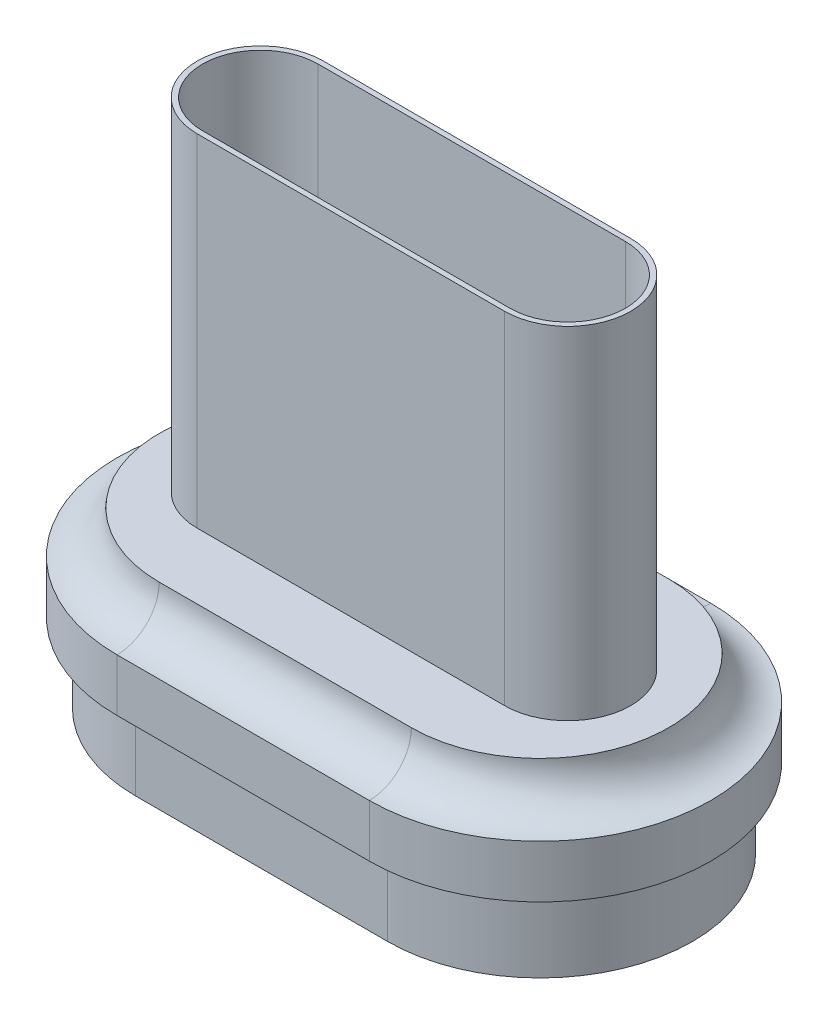
from build123d import *

# Parameters (mm, degrees)
BOSS_EXTRUDE1_DEPTH = 1.5
BOSS_EXTRUDE2_DEPTH = 1
BOSS_EXTRUDE4_DEPTH = 0.8
BOSS_EXTRUDE3_DEPTH = 6.5
FILLET1_R           = 0.8


with BuildPart() as part:
    # Sketch1 → Boss-Extrude1 (new body)
    with BuildSketch(Plane(origin=(0, 0, 0), x_dir=(1, 0, 0), z_dir=(0, 1, 0))):
        with BuildLine():
            Line((-2.4, 2.9), (2.4, 2.9))
            ThreePointArc((2.4, 2.9), (5.3, 0), (2.4, -2.9))
            Line((2.4, -2.9), (-2.4, -2.9))
            ThreePointArc((-2.4, -2.9), (-5.3, 0), (-2.4, 2.9))
        make_face()
        with BuildLine():
            Line((-2.4, 1.4), (2.4, 1.4))
            ThreePointArc((2.4, 1.4), (3.8, 0), (2.4, -1.4))
            Line((2.4, -1.4), (-2.4, -1.4))
            ThreePointArc((-2.4, -1.4), (-3.8, 0), (-2.4, 1.4))
        make_face(mode=Mode.SUBTRACT)
    extrude(amount=BOSS_EXTRUDE1_DEPTH)

    # Sketch2 → Boss-Extrude2 (add)
    with BuildSketch(Plane(origin=(0, 1.5, 0), x_dir=(1, 0, 0), z_dir=(0, 1, 0))):
        with BuildLine():
            Line((-2.4, -3.25), (2.4, -3.25))
            ThreePointArc((2.4, -3.25), (5.65, 0), (2.4, 3.25))
            Line((2.4, 3.25), (-2.4, 3.25))
            ThreePointArc((-2.4, 3.25), (-5.65, 0), (-2.4, -3.25))
        make_face()
    extrude(amount=BOSS_EXTRUDE2_DEPTH)

    # Sketch4 → Boss-Extrude4 (add)
    with BuildSketch(Plane(origin=(0, 2.5, 0), x_dir=(1, 0, 0), z_dir=(0, 1, 0))):
        with BuildLine():
            Line((-2.4, -2.45), (2.4, -2.45))
            ThreePointArc((2.4, -2.45), (4.85, 0), (2.4, 2.45))
            Line((2.4, 2.45), (-2.4, 2.45))
            ThreePointArc((-2.4, 2.45), (-4.85, 0), (-2.4, -2.45))
        make_face()
    extrude(amount=BOSS_EXTRUDE4_DEPTH)

    # Sketch3 → Boss-Extrude3 (add)
    with BuildSketch(Plane(origin=(0, 3.3, 0), x_dir=(1, 0, 0), z_dir=(0, 1, 0))):
        with BuildLine():
            Line((-2.925, 1.2), (2.925, 1.2))
            ThreePointArc((2.925, 1.2), (4.125, 0), (2.925, -1.2))
            Line((2.925, -1.2), (-2.925, -1.2))
            ThreePointArc((-2.925, -1.2), (-4.125, 0), (-2.925, 1.2))
        make_face()
        with BuildLine():
            Line((-2.925, 1.1), (2.925, 1.1))
            ThreePointArc((2.925, 1.1), (4.025, 0), (2.925, -1.1))
            Line((2.925, -1.1), (-2.925, -1.1))
            ThreePointArc((-2.925, -1.1), (-4.025, 0), (-2.925, 1.1))
        make_face(mode=Mode.SUBTRACT)
    extrude(amount=BOSS_EXTRUDE3_DEPTH)

    # Fillet1
    fillet1_edges = [part.edges().sort_by_distance(p)[0] for p in [
        (-4.85, 2.5, 0),
        (0, 2.5, -2.45),
        (4.85, 2.5, 0),
        (0, 2.5, 2.45),
    ]]
    fillet(fillet1_edges, radius=FILLET1_R - 0.0001)  # a hair under: the kernel refuses the full size


solid = part.part
